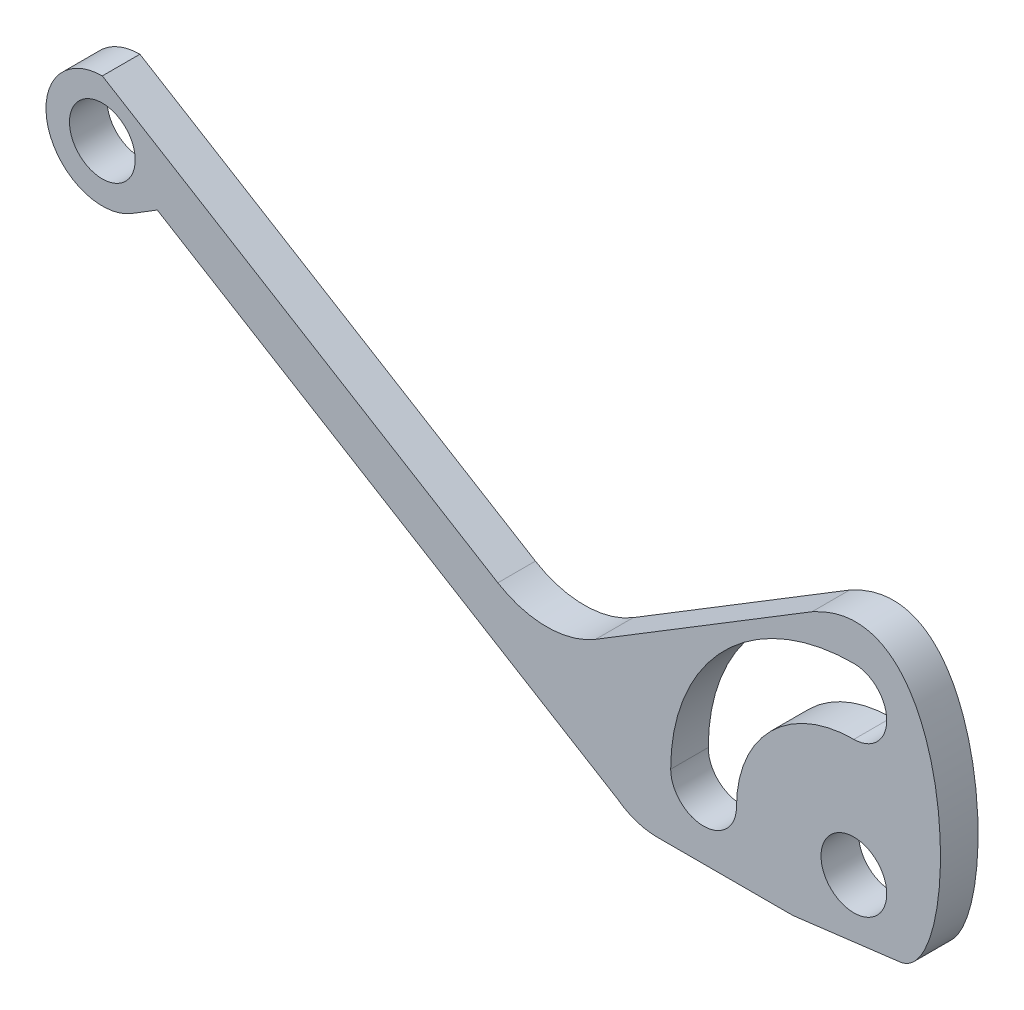
from build123d import *

# Parameters (mm, degrees)
SKETCH1_R           = 1.75
BOSS_EXTRUDE1_DEPTH = 2
SCALE1_DEPTH        = 2
SCALE1_START        = -0.999997816
SCALE1_2_OUTLINE_R  = 3.5
SCALE1_2_DEPTH      = 4


# Read off the part's stored shape, not the designer's step: Scale1
with BuildPart() as part:
    # Sketch1 → Boss-Extrude1 (new body)
    with BuildSketch(Plane.XY):
        with BuildLine():
            Line((37.774530777, -2.80976251), (26.258490635, -9.838609559))
            ThreePointArc((26.258490635, -9.838609559), (23.654335286, -10.570760941), (21.04996396, -9.839378194))
            Line((21.04996396, -9.839378194), (0, 3))
            ThreePointArc((0, 3), (-2.885775614, -0.819938477), (1.577438975, -2.551800596))
            Line((1.577438975, -2.551800596), (2.923005699, -1.720015621))
            Line((2.923005699, -1.720015621), (27.42442319, -16.619165126))
            ThreePointArc((27.42442319, -16.619165126), (28.420022181, -17.142817893), (29.530314816, -17.323593546))
            Line((29.530314816, -17.323593546), (36.531170313, -17.323593546))
            ThreePointArc((36.531170313, -17.323593546), (36.747003069, -17.316932382), (36.962014284, -17.296974244))
            Line((36.962014284, -17.296974244), (42.4263802, -16.619165126))
            add(Edge.make_bspline(
                [(37.774530777, -2.80976251), (45.652503852, 1.576646515), (46.016818074, -16.230167124), (42.4263802, -16.619165126)],
                knots=[0, 0, 0, 0, 1, 1, 1, 1], degree=3))
        make_face()
        Circle(SKETCH1_R, mode=Mode.SUBTRACT)
        with Locations((40, -13.83)):
            Circle(SKETCH1_R, mode=Mode.SUBTRACT)
        with BuildLine():
            ThreePointArc((40, -7.58), (41.75, -5.83), (40, -4.08))
            ThreePointArc((40, -4.08), (33.105708883, -6.935708883), (30.25, -13.83))
            ThreePointArc((30.25, -13.83), (32, -15.58), (33.75, -13.83))
            ThreePointArc((33.75, -13.83), (35.580582618, -9.410582618), (40, -7.58))
        make_face(mode=Mode.SUBTRACT)
    extrude(amount=BOSS_EXTRUDE1_DEPTH)

    # Scale1 outline → Scale1 (cut)
    with BuildSketch(Plane.XY):
        with BuildLine():
            Line((25.309397888, -10.313026346), (25.407923969, -10.252890679))
            ThreePointArc((25.407923969, -10.252890679), (23.18128534, -10.548403138), (21.04996396, -9.839378194))
            Line((21.04996396, -9.839378194), (0, 3))
            ThreePointArc((0, 3), (-1.910769589, 2.312781783), (-2.946128732, 0.565973052))
            Line((-2.946128732, 0.565973052), (-1.741862619, -0.168566356))
            ThreePointArc((-1.741862619, -0.168566356), (0.911271712, 1.494016019), (0.647354046, -1.62586369))
            Line((0.647354046, -1.62586369), (1.869458664, -2.371283654))
            Line((1.869458664, -2.371283654), (2.923005699, -1.720015621))
            Line((2.923005699, -1.720015621), (19.42459166, -11.75452062))
            ThreePointArc((19.42459166, -11.75452062), (22.478792733, -11.490181349), (25.309397888, -10.313026346))
        make_face()
        with BuildLine():
            add(Edge.make_bspline(
                [(41.45450238, -2.430697688), (43.278912085, -3.340053045), (44.251250713, -6.082636591), (44.527913808, -8.917748085)],
                knots=[0.188633601, 0.188633601, 0.188633601, 0.188633601, 0.541520813, 0.541520813, 0.541520813, 0.541520813], degree=3))
            ThreePointArc((41.45450238, -2.430697688), (40.4125829, -3.229629308), (39.426788196, -4.096864419))
            ThreePointArc((39.426788196, -4.096864419), (39.713270083, -4.084217017), (40, -4.08))
            ThreePointArc((40, -4.08), (41.75, -5.83), (40, -7.58))
            ThreePointArc((40, -7.58), (37.394812966, -8.148846903), (35.263850756, -9.751839835))
            ThreePointArc((35.263850756, -9.751839835), (33.906901167, -13.439130778), (33.316667581, -17.323593546))
            Line((33.316667581, -17.323593546), (36.531170313, -17.323593546))
            ThreePointArc((36.531170313, -17.323593546), (36.747003069, -17.316932382), (36.962014284, -17.296974244))
            Line((36.962014284, -17.296974244), (40.373564213, -16.873799866))
            ThreePointArc((40.373564213, -16.873799866), (40.47496583, -16.16733217), (40.616522643, -15.467803355))
            ThreePointArc((40.616522643, -15.467803355), (38.347783736, -13.253214584), (41.501863894, -12.931721176))
            ThreePointArc((41.501863894, -12.931721176), (42.811031733, -10.771051035), (44.527913808, -8.917748085))
        make_face()
    extrude(amount=SCALE1_DEPTH, mode=Mode.SUBTRACT)

    # Scale1 2 outline → Scale1 2 (add)
    with BuildSketch(Plane.XY.offset(SCALE1_START)):
        with BuildLine():
            add(Edge.make_bspline(
                [(48.341478172, 3.744667751), (64.097424322, 12.517485802), (64.826052766, -23.096141476), (57.645177019, -23.874137481)],
                knots=[0, 0, 0, 0, 1, 1, 1, 1], degree=3))
            Line((48.341478172, 3.744667751), (25.309397888, -10.313026346))
            ThreePointArc((25.309397888, -10.313026346), (20.101087191, -11.77732911), (14.892344539, -10.314563616))
            Line((14.892344539, -10.314563616), (-27.207583382, 15.364192772))
            ThreePointArc((-27.207583382, 15.364192772), (-32.97913461, 7.724315817), (-24.052705432, 4.26059158))
            Line((-24.052705432, 4.26059158), (-21.361571984, 5.924161529))
            Line((-21.361571984, 5.924161529), (27.641262999, -23.874137481))
            ThreePointArc((27.641262999, -23.874137481), (29.632460981, -24.921443014), (31.85304625, -25.28299432))
            Line((31.85304625, -25.28299432), (45.854757245, -25.28299432))
            ThreePointArc((45.854757245, -25.28299432), (46.286422756, -25.269671992), (46.716445185, -25.229755716))
            Line((46.716445185, -25.229755716), (57.645177019, -23.874137481))
        make_face()
        with BuildLine():
            ThreePointArc((33.292416618, -18.295807228), (39.003834385, -4.507224995), (52.792416618, 1.204192772))
            ThreePointArc((52.792416618, 1.204192772), (56.292416618, -2.295807228), (52.792416618, -5.795807228))
            ThreePointArc((52.792416618, -5.795807228), (43.953581853, -9.456972464), (40.292416618, -18.295807228))
            ThreePointArc((40.292416618, -18.295807228), (36.792416618, -21.795807228), (33.292416618, -18.295807228))
        make_face(mode=Mode.SUBTRACT)
        with Locations((52.792416618, -18.295807228)):
            Circle(SCALE1_2_OUTLINE_R, mode=Mode.SUBTRACT)
        with Locations((-27.207583382, 9.364192772)):
            Circle(SCALE1_2_OUTLINE_R, mode=Mode.SUBTRACT)
    extrude(amount=SCALE1_2_DEPTH)


solid = part.part
